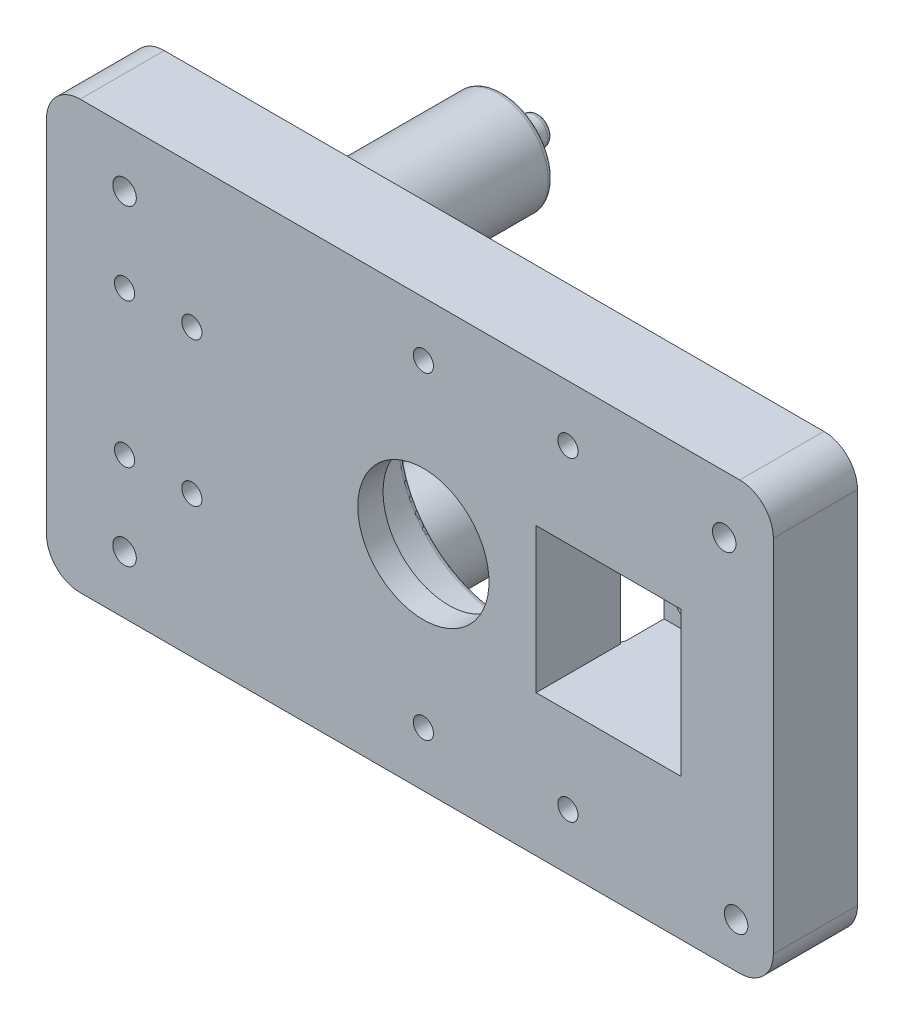
from build123d import *

# Parameters (mm, degrees)
SKETCH1_W            = 216
SKETCH1_H            = 127
BOSS_EXTRUDE1_DEPTH  = 25
FILLET1_R            = 10
FILLET2_R            = 10
SKETCH9_R            = 31
CUT_EXTRUDE4_DEPTH   = 17.5
SKETCH12_R           = 19.5
CUT_EXTRUDE5_DEPTH   = 127.500988138
SKETCH9_4_W          = 43
SKETCH9_4_H          = 43
CUT_EXTRUDE6_DEPTH   = 128.754647665
SKETCH13_W           = 43
SKETCH13_H           = 4
BOSS_EXTRUDE2_DEPTH  = 17
FILLET4_R            = 2
SKETCH17_W           = 43
SKETCH17_H           = 4
BOSS_EXTRUDE5_DEPTH  = 9
SKETCH18_W           = 43
SKETCH18_H           = 4
BOSS_EXTRUDE6_DEPTH  = 17
SKETCH19_W           = 43
SKETCH19_H           = 4
BOSS_EXTRUDE7_DEPTH  = 9
FILLET5_R            = 2
SKETCH20_R           = 1.85
CUT_EXTRUDE7_DEPTH   = 9
SKETCH23_R           = 1.85
CUT_EXTRUDE8_DEPTH   = 9
SKETCH25_R           = 15
BOSS_EXTRUDE9_DEPTH  = 45
SKETCH26_R           = 4.15
BOSS_EXTRUDE10_DEPTH = 10.75
SKETCH27_R           = 4.15
BOSS_EXTRUDE11_DEPTH = 10.75
FILLET9_R            = 2
FILLET10_R           = 2
SKETCH28_R           = 3.5
CUT_EXTRUDE9_DEPTH   = 150.053052636
SKETCH29_R           = 3
CUT_EXTRUDE11_DEPTH  = 138.128817176
FILLET11_R           = 1.5
FILLET12_R           = 1.5
FILLET13_R           = 1.5
SKETCH30_R           = 5.6
BOSS_EXTRUDE13_DEPTH = 2


with BuildPart() as part:
    # Sketch1 → Boss-Extrude1 (new body)
    with BuildSketch(Plane.XY):
        Rectangle(SKETCH1_W, SKETCH1_H)
    extrude(amount=BOSS_EXTRUDE1_DEPTH)

    # Fillet1
    fillet1_edges = [part.edges().sort_by_distance(p)[0] for p in [
        (-108, 63.5, 12.5),
    ]]
    fillet(fillet1_edges, radius=FILLET1_R)

    # Fillet2
    fillet2_edges = [part.edges().sort_by_distance(p)[0] for p in [
        (-108, -63.5, 12.5),
        (108, 63.5, 12.5),
        (108, -63.5, 12.5),
    ]]
    fillet(fillet2_edges, radius=FILLET2_R)

    # Sketch9 → Cut-Extrude4 (cut)
    with BuildSketch(Plane(origin=(0, 0, 0), x_dir=(-1, 0, 0), z_dir=(0, 0, -1))):
        with Locations((-4, 0)):
            Circle(SKETCH9_R)
    extrude(amount=-CUT_EXTRUDE4_DEPTH, mode=Mode.SUBTRACT)

    # Sketch12 → Cut-Extrude5 (cut, through all)
    with BuildSketch(Plane(origin=(0, 0, 17.5), x_dir=(-1, 0, 0), z_dir=(0, 0, -1))):
        with Locations((-4, 0)):
            Circle(SKETCH12_R)
    extrude(amount=-CUT_EXTRUDE5_DEPTH, mode=Mode.SUBTRACT)

    # Sketch9<4> → Cut-Extrude6 (cut, through all)
    with BuildSketch(Plane(origin=(0, 0, 0), x_dir=(-1, 0, 0), z_dir=(0, 0, -1))):
        with Locations((-59, 0)):
            Rectangle(SKETCH9_4_W, SKETCH9_4_H)
    extrude(amount=-CUT_EXTRUDE6_DEPTH, mode=Mode.SUBTRACT)

    # Sketch13 → Boss-Extrude2 (add)
    with BuildSketch(Plane(origin=(0, 0, 0), x_dir=(-1, 0, 0), z_dir=(0, 0, -1))):
        with Locations((-59, -23.5)):
            Rectangle(SKETCH13_W, SKETCH13_H)
    extrude(amount=BOSS_EXTRUDE2_DEPTH)

    # Fillet4
    fillet4_edges = [part.edges().sort_by_distance(p)[0] for p in [
        (59, -25.5, 0),
        (37.5, -23.5, 0),
        (80.5, -23.5, 0),
    ]]
    fillet(fillet4_edges, radius=FILLET4_R)

    # Sketch17 → Boss-Extrude5 (add)
    with BuildSketch(Plane(origin=(0, -21.5, 0), x_dir=(1, 0, 0), z_dir=(0, 1, 0))):
        with Locations((59, 15)):
            Rectangle(SKETCH17_W, SKETCH17_H)
    extrude(amount=BOSS_EXTRUDE5_DEPTH)

    # Sketch18 → Boss-Extrude6 (add)
    with BuildSketch(Plane(origin=(0, 0, 0), x_dir=(-1, 0, 0), z_dir=(0, 0, -1))):
        with Locations((-59, 23.5)):
            Rectangle(SKETCH18_W, SKETCH18_H)
    extrude(amount=BOSS_EXTRUDE6_DEPTH)

    # Sketch19 → Boss-Extrude7 (add)
    with BuildSketch(Plane(origin=(0, 21.5, 0), x_dir=(-1, 0, 0), z_dir=(0, -1, 0))):
        with Locations((-59, 15)):
            Rectangle(SKETCH19_W, SKETCH19_H)
    extrude(amount=BOSS_EXTRUDE7_DEPTH)

    # Fillet5
    fillet5_edges = [part.edges().sort_by_distance(p)[0] for p in [
        (37.5, 23.5, 0),
        (80.5, 23.5, 0),
        (59, 25.5, 0),
    ]]
    fillet(fillet5_edges, radius=FILLET5_R)

    # Sketch20 → Cut-Extrude7 (cut)
    with BuildSketch(Plane(origin=(0, 0, -17), x_dir=(-1, 0, 0), z_dir=(0, 0, -1))):
        with Locations((-43.15, -16)):
            Circle(SKETCH20_R)
        with Locations((-74.85, -16)):
            Circle(SKETCH20_R)
    extrude(amount=-CUT_EXTRUDE7_DEPTH, mode=Mode.SUBTRACT)

    # Sketch23 → Cut-Extrude8 (cut)
    with BuildSketch(Plane(origin=(0, 0, -17), x_dir=(-1, 0, 0), z_dir=(0, 0, -1))):
        with Locations((-43.15, 15.85)):
            Circle(SKETCH23_R)
        with Locations((-74.85, 16)):
            Circle(SKETCH23_R)
    extrude(amount=-CUT_EXTRUDE8_DEPTH, mode=Mode.SUBTRACT)

    # Sketch25 → Boss-Extrude9 (add)
    with BuildSketch(Plane(origin=(0, 0, 0), x_dir=(-1, 0, 0), z_dir=(0, 0, -1))):
        with Locations((42.424121096, -43.5)):
            Circle(SKETCH25_R)
        with Locations((42.424121096, 43.5)):
            Circle(SKETCH25_R)
    extrude(amount=BOSS_EXTRUDE9_DEPTH)

    # Sketch26 → Boss-Extrude10 (add)
    with BuildSketch(Plane(origin=(0, 0, -45), x_dir=(-1, 0, 0), z_dir=(0, 0, -1))):
        with Locations((42.424121096, -43.5)):
            Circle(SKETCH26_R)
    extrude(amount=BOSS_EXTRUDE10_DEPTH)

    # Sketch27 → Boss-Extrude11 (add)
    with BuildSketch(Plane(origin=(0, 0, -45), x_dir=(-1, 0, 0), z_dir=(0, 0, -1))):
        with Locations((42.424121096, 43.5)):
            Circle(SKETCH27_R)
    extrude(amount=BOSS_EXTRUDE11_DEPTH)

    # Fillet9
    fillet9_edges = [part.edges().sort_by_distance(p)[0] for p in [
        (-27.424121096, -43.5, 0),
    ]]
    fillet(fillet9_edges, radius=FILLET9_R)

    # Fillet10
    fillet10_edges = [part.edges().sort_by_distance(p)[0] for p in [
        (-27.424121096, 43.5, 0),
    ]]
    fillet(fillet10_edges, radius=FILLET10_R)

    # Sketch28 → Cut-Extrude9 (cut, through all)
    with BuildSketch(Plane.XY.offset(25)):
        with Locations((-84.811667967, 46.37)):
            Circle(SKETCH28_R)
        with Locations((-84.811667967, -46.37)):
            Circle(SKETCH28_R)
        with Locations((96.914555393, -50.172567055)):
            Circle(SKETCH28_R)
        with Locations((93.399057455, 46.37)):
            Circle(SKETCH28_R)
    extrude(amount=-CUT_EXTRUDE9_DEPTH, mode=Mode.SUBTRACT)

    # Sketch29 → Cut-Extrude11 (cut, through all)
    with BuildSketch(Plane(origin=(0, 0, 0), x_dir=(-1, 0, 0), z_dir=(0, 0, -1))):
        with Locations((-46.949528727, 46.81)):
            Circle(SKETCH29_R)
        with Locations((-4, 47.25)):
            Circle(SKETCH29_R)
        with Locations((-4, -47.25)):
            Circle(SKETCH29_R)
        with Locations((-46.949528727, -46.81)):
            Circle(SKETCH29_R)
        with Locations((84.811667967, -21.435)):
            Circle(SKETCH29_R)
        with Locations((84.811667967, 21.435)):
            Circle(SKETCH29_R)
        with Locations((64.811667967, 21.435)):
            Circle(SKETCH29_R)
        with Locations((64.811667967, -21.435)):
            Circle(SKETCH29_R)
    extrude(amount=-CUT_EXTRUDE11_DEPTH, mode=Mode.SUBTRACT)

    # Fillet11
    fillet11_edges = [part.edges().sort_by_distance(p)[0] for p in [
        (35, 0, 0),
    ]]
    fillet(fillet11_edges, radius=FILLET11_R)

    # Fillet12
    fillet12_edges = [part.edges().sort_by_distance(p)[0] for p in [
        (-27.424121096, -43.5, -45),
        (-27.424121096, 43.5, -45),
    ]]
    fillet(fillet12_edges, radius=FILLET12_R)

    # Fillet13
    fillet13_edges = [part.edges().sort_by_distance(p)[0] for p in [
        (-38.274121096, 43.5, -55.75),
        (-38.274121096, -43.5, -55.75),
    ]]
    fillet(fillet13_edges, radius=FILLET13_R)

    # Sketch30 → Boss-Extrude13 (add)
    with BuildSketch(Plane(origin=(0, 0, -45), x_dir=(-1, 0, 0), z_dir=(0, 0, -1))):
        with Locations((42.424121096, 43.5)):
            Circle(SKETCH30_R)
        with Locations((42.424121096, -43.5)):
            Circle(SKETCH30_R)
    extrude(amount=BOSS_EXTRUDE13_DEPTH)


solid = part.part
